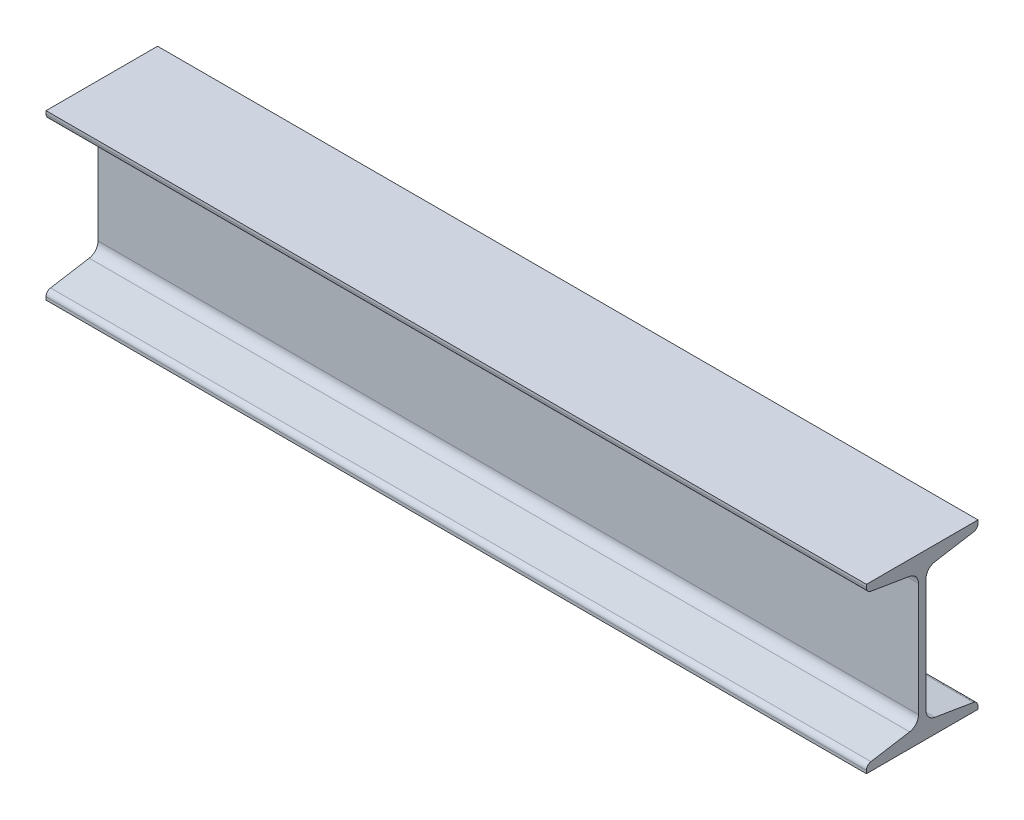
from build123d import *

# Parameters (mm, degrees)
BASE_DEPTH = 500
FILLET1_R  = 6.5
FILLET2_R  = 3.3


with BuildPart() as part:
    # Sketch1 → Base (new body)
    with BuildSketch(Plane(origin=(0, 0, 0), x_dir=(0, 0, -1), z_dir=(1, 0, 0))):
        Polygon((-34, 0), (34, 0), (34, 4.579166667), (2.25, 9.870833333), (2.25, 90.129166667), (34, 95.420833333), (34, 100), (-34, 100), (-34, 95.420833333), (-2.25, 90.129166667), (-2.25, 9.870833333), (-34, 4.579166667), align=None)
    extrude(amount=BASE_DEPTH)

    # Fillet1
    fillet1_edges = [part.edges().sort_by_distance(p)[0] for p in [
        (250, 90.129166667, -2.25),
        (250, 9.870833333, -2.25),
        (250, 9.870833333, 2.25),
        (250, 90.129166667, 2.25),
    ]]
    fillet(fillet1_edges, radius=FILLET1_R)

    # Fillet2
    fillet2_edges = [part.edges().sort_by_distance(p)[0] for p in [
        (250, 95.420833333, 34),
        (250, 4.579166667, 34),
        (250, 4.579166667, -34),
        (250, 95.420833333, -34),
    ]]
    fillet(fillet2_edges, radius=FILLET2_R)


solid = part.part
